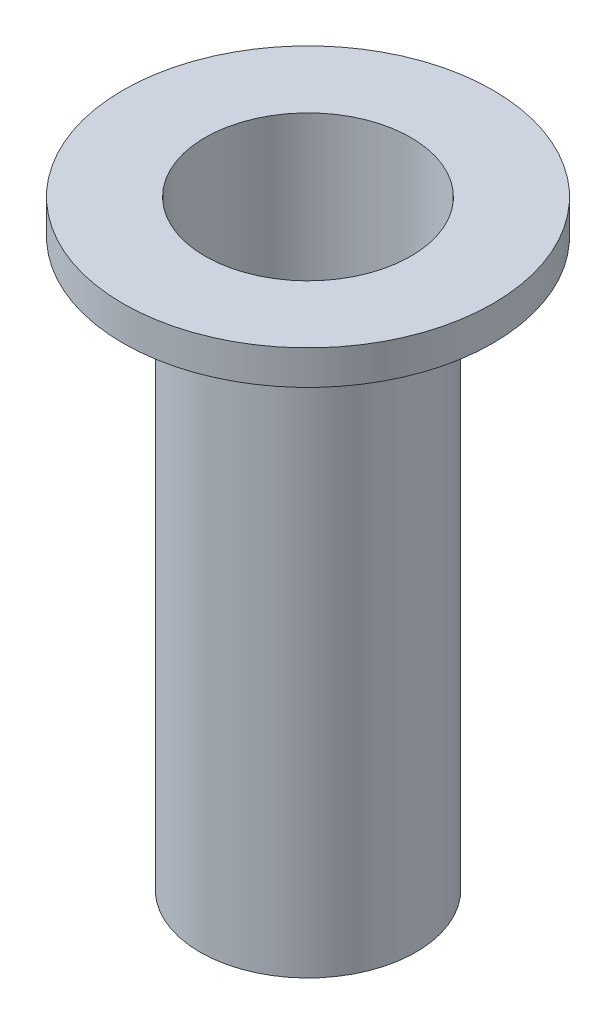
from build123d import *

# Parameters (mm, degrees)
SKETCH1_R           = 8.001
BOSS_EXTRUDE1_DEPTH = 44.45
SKETCH2_R           = 7.62
CUT_EXTRUDE1_DEPTH  = 43.18
SKETCH3_R           = 6.35
CUT_EXTRUDE2_DEPTH  = 1.27
CHAMFER2_SIZE       = 1.27


with BuildPart() as part:
    # Sketch1 → Boss-Extrude1 (new body)
    with BuildSketch(Plane(origin=(0, 0, 0), x_dir=(1, 0, 0), z_dir=(0, 1, 0))):
        with Locations(Location((0, 0, 0), (0, 0, 270))):
            Circle(SKETCH1_R)
    extrude(amount=BOSS_EXTRUDE1_DEPTH)

    # Sketch2 → Cut-Extrude1 (cut)
    with BuildSketch(Plane(origin=(0, 44.45, 0), x_dir=(1, 0, 0), z_dir=(0, 1, 0))):
        with Locations(Location((0, 0, 0), (0, 0, 270))):
            Circle(SKETCH2_R)
    extrude(amount=-CUT_EXTRUDE1_DEPTH, mode=Mode.SUBTRACT)

    # Sketch3 → Cut-Extrude2 (cut)
    with BuildSketch(Plane(origin=(0, 1.27, 0), x_dir=(1, 0, 0), z_dir=(0, 1, 0))):
        with Locations(Location((0, 0, 0), (0, 0, 270))):
            Circle(SKETCH3_R)
    extrude(amount=-CUT_EXTRUDE2_DEPTH, mode=Mode.SUBTRACT)

    # Chamfer2
    chamfer2_edges = [part.edges().sort_by_distance(p)[0] for p in [
        (0, 0, -6.35),
    ]]
    chamfer(chamfer2_edges, length=CHAMFER2_SIZE - 0.0001)  # a hair under: the kernel refuses the full size

    # Sketch5 → Revolve1 (revolve)
    with BuildSketch(Plane.XY, mode=Mode.PRIVATE) as revolve1_sk:
        with BuildLine():
            Line((8.001, 44.45), (13.698005601, 44.45))
            Line((13.698005601, 44.45), (13.698005601, 41.91))
            ThreePointArc((13.698005601, 41.91), (10.812623084, 41.67859503), (8.001, 40.990295557))
            Line((8.001, 40.990295557), (8.001, 44.45))
        make_face()
    revolve(revolve1_sk.sketch.rotate(Axis((0, 1.27, 0), (0, 1, 0)), 90), axis=Axis((0, 1.27, 0), (0, 1, 0)))


solid = part.part
